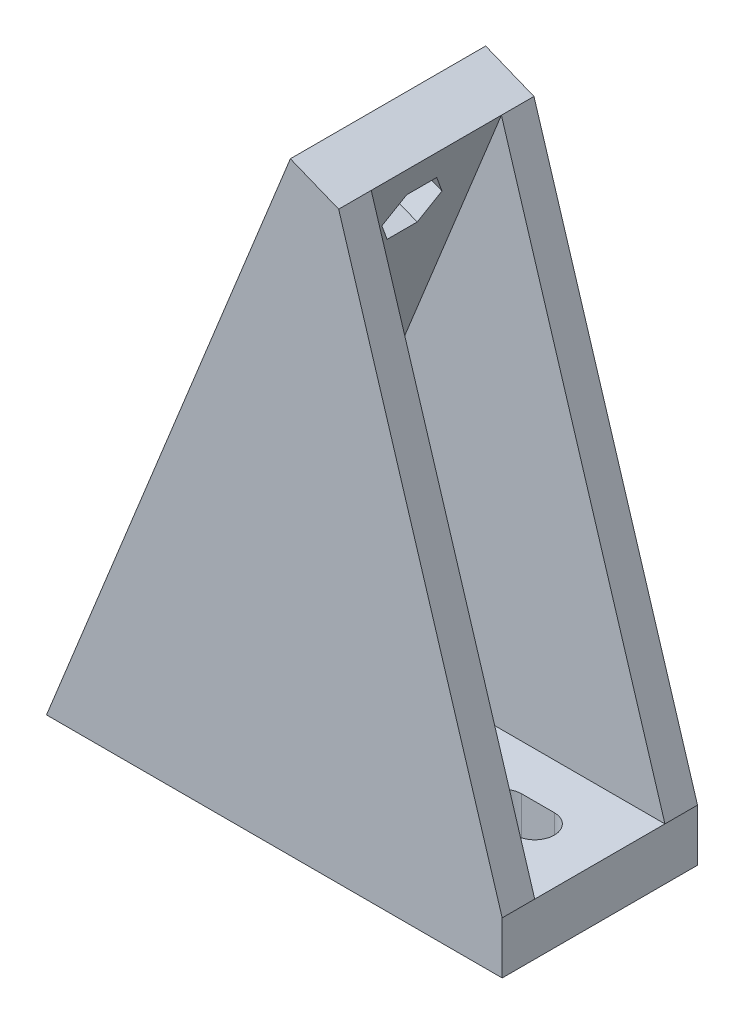
from build123d import *

# Parameters (mm, degrees)
BOSS_EXTRUDE1_DEPTH           = 15
CUT_EXTRUDE1_DEPTH            = 111.91530478
RIB1_REACH                    = 121.986
SKETCH4_WALL_W                = 327.46820492
SKETCH4_WALL_H                = 5
M4_CLEARANCE_HOLE1_AT_2_COUNT = 2
M4_CLEARANCE_HOLE1_AT_2_PITCH = 63.139512252
CUT_EXTRUDE2_DEPTH            = 3


with BuildPart() as part:
    # Sketch1 → Boss-Extrude1 (new, symmetric)
    with BuildSketch(Plane.XY):
        Polygon((0, 0), (37.460659342, 92.718385457), (44.878130178, 89.721532709), (11.860487748, 8), (70, 8), (70, 0), align=None)
    extrude(amount=BOSS_EXTRUDE1_DEPTH, both=True)

    # Sketch2 → Cut-Extrude1 (cut, through all)
    with BuildSketch(Plane(origin=(0, 8, 0), x_dir=(1, 0, 0), z_dir=(0, 1, 0))):
        with BuildLine():
            Line((60, -3), (55, -3))
            ThreePointArc((55, -3), (52, 0), (55, 3))
            Line((55, 3), (60, 3))
            ThreePointArc((60, 3), (63, 0), (60, -3))
        make_face()
    extrude(amount=-CUT_EXTRUDE1_DEPTH, mode=Mode.SUBTRACT)

    # Sketch4 wall → Rib1 (add, up to next)
    with BuildSketch(Plane(origin=(57.439065089, 48.860766355, 15), x_dir=(0.293837765746, -0.955855306739, 0), z_dir=(0.955855306739, 0.293837765746, 0)), mode=Mode.PRIVATE) as rib1_sk1:
        with Locations((0, 2.5)):
            Rectangle(SKETCH4_WALL_W, SKETCH4_WALL_H)
    rib1_tool1 = extrude(rib1_sk1.sketch, amount=-RIB1_REACH, mode=Mode.PRIVATE) - part.part
    rib1 = rib1_tool1.solids().sort_by_distance((57.439065089, 48.860766355, 15))[0]
    add(rib1)

    # Mirror1: Rib1 across plane
    add(rib1.mirror(Plane.XY))

    # Sketch7 → M4 Clearance Hole1 (revolve, cut)
    with BuildSketch(Plane(origin=(41.132064244, 80.449694164, 0), x_dir=(0.37460659341591607, 0.9271838545667858, 0), z_dir=(0, 0, 1))):
        Polygon((0, 0), (0, 42.732918523), (2.25, 42.732918523), (2.25, 0.025), (2.275, 0), align=None)
    m4_clearance_hole1 = revolve(axis=Axis((47.01968172, 78.070942295, 0), (-0.9271838545667858, 0.37460659341591607, 0)), mode=Mode.SUBTRACT)

    # M4 Clearance Hole1 at 2: M4 Clearance Hole1 ×2
    with Locations(*[Vector(-0.37460659341591607, -0.9271838545667858, 0) * (i * M4_CLEARANCE_HOLE1_AT_2_PITCH) for i in range(1, M4_CLEARANCE_HOLE1_AT_2_COUNT)]):
        add(m4_clearance_hole1, mode=Mode.SUBTRACT)

    # Sketch8 → Cut-Extrude2 (cut)
    with BuildSketch(Plane(origin=(7.417470837, -2.996852747, 0), x_dir=(0, 0, -1), z_dir=(0.9271838545667858, -0.37460659341591607, 0))):
        Polygon((4.618802154, 90), (2.309401077, 94), (-2.309401077, 94), (-4.618802154, 90), (-2.309401077, 86), (2.309401077, 86), align=None)
        Polygon((4.618802154, 26.860487748), (2.309401077, 30.860487748), (-2.309401077, 30.860487748), (-4.618802154, 26.860487748), (-2.309401077, 22.860487748), (2.309401077, 22.860487748), align=None)
    extrude(amount=-CUT_EXTRUDE2_DEPTH, mode=Mode.SUBTRACT)


solid = part.part
